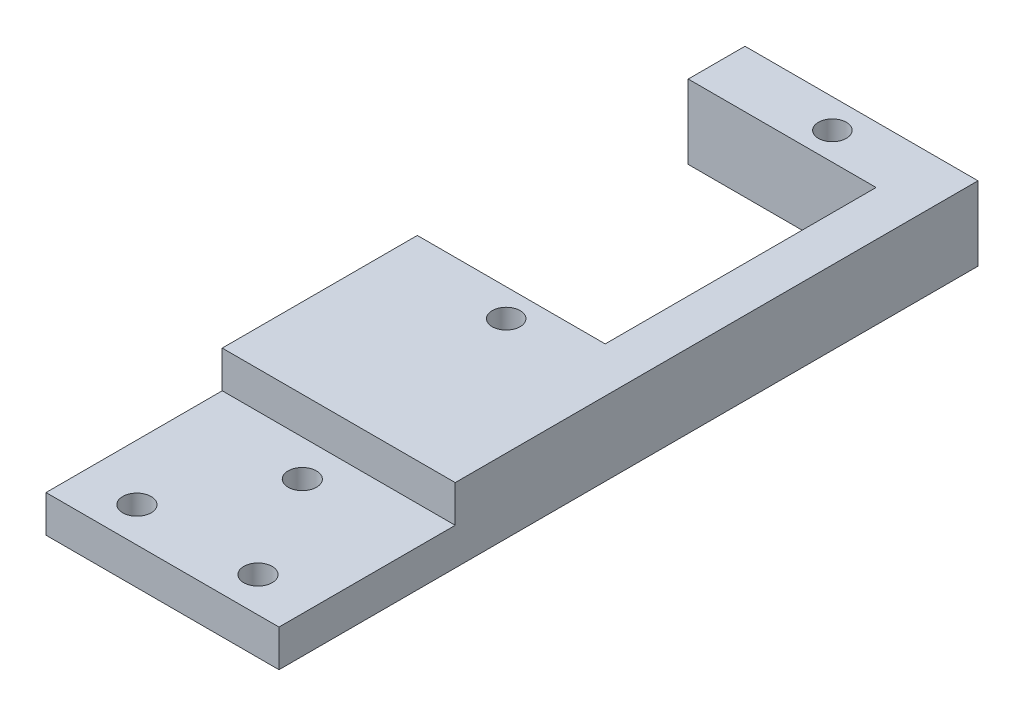
from build123d import *

# Parameters (mm, degrees)
SKETCH2_W             = 20
SKETCH2_H             = 60
BOSS_EXTRUDE1_DEPTH   = 6.35
SKETCH4_W             = 16.127
SKETCH4_H             = 23.254
CUT_EXTRUDE1_DEPTH    = 64.563531211
M2_CLEARANCE_HOLE1_D  = 2.4
SKETCH10_W            = 15.127
SKETCH10_H            = 3.175
CUT_EXTRUDE2_DEPTH    = 64.563531211
F_2_CLEARANCE_HOLE1_D = 2.4384


with BuildPart() as part:
    # Sketch2 → Boss-Extrude1 (new body)
    with BuildSketch(Plane(origin=(0, 0, 0), x_dir=(1, 0, 0), z_dir=(0, 1, 0))):
        with Locations((10, -30)):
            Rectangle(SKETCH2_W, SKETCH2_H)
    extrude(amount=BOSS_EXTRUDE1_DEPTH)

    # Sketch4 → Cut-Extrude1 (cut, through all)
    with BuildSketch(Plane(origin=(0, 6.35, 0), x_dir=(1, 0, 0), z_dir=(0, 1, 0))):
        with Locations((8.0635, -16.5)):
            Rectangle(SKETCH4_W, SKETCH4_H)
    extrude(amount=-CUT_EXTRUDE1_DEPTH, mode=Mode.SUBTRACT)

    # M2 Clearance Hole1 (through all)
    with Locations(Plane(origin=(0, 6.35, 0), x_dir=(1, 0, 0), z_dir=(0, 1, 0))):
        with Locations((10, -30.5), (10, -2.5)):
            Hole(M2_CLEARANCE_HOLE1_D / 2)

    # Sketch10 → Cut-Extrude2 (cut, through all)
    with BuildSketch(Plane(origin=(20, 0, 0), x_dir=(0, 0, -1), z_dir=(1, 0, 0))):
        with Locations((-52.4365, 4.7625)):
            Rectangle(SKETCH10_W, SKETCH10_H)
    extrude(amount=-CUT_EXTRUDE2_DEPTH, mode=Mode.SUBTRACT)

    # #2 Clearance Hole1 (through all)
    with Locations(Plane(origin=(0, 3.175, 0), x_dir=(1, 0, 0), z_dir=(0, 1, 0))):
        with Locations((10, -48), (4.803847577, -57), (15.196152423, -57)):
            Hole(F_2_CLEARANCE_HOLE1_D / 2)


solid = part.part
